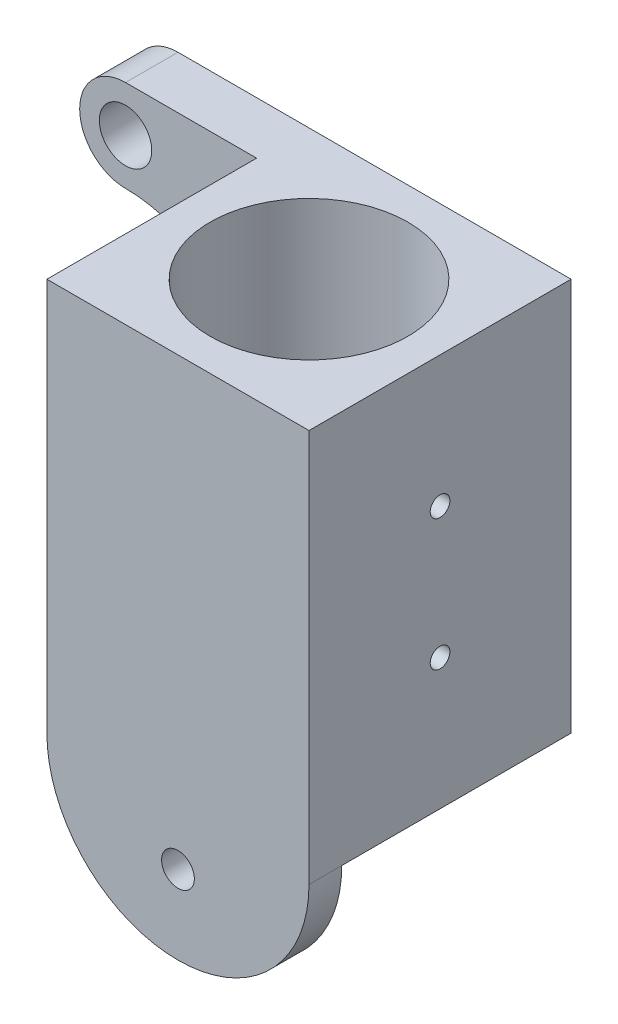
from build123d import *

# Parameters (mm, degrees)
SKETCH_1_W             = 40
SKETCH_1_H             = 40
EXTRUDE_1_DEPTH        = 60
SKETCH_2_R             = 15.1
CUT_EXTRUDE_1_DEPTH    = 50
SKETCH_3_R             = 2.5
EXTRUDE_2_DEPTH        = 5
SKETCH_4_R             = 1.5
CUT_EXTRUDE_2_DEPTH    = 75.833147735
PATTERN_LINEAR_1_COUNT = 2
PATTERN_LINEAR_1_PITCH = 20
SKETCH_5_W             = 8
SKETCH_5_H             = 14
EXTRUDE_3_DEPTH        = 27
FILLET_1_R             = 7
CUT_EXTRUDE_3_REACH    = 88.076
SKETCH_6_R             = 4
FILLET_2_R             = 20


with BuildPart() as part:
    # 草圖1 → 填料-伸長1 (new body)
    with BuildSketch(Plane(origin=(0, 0, 0), x_dir=(1, 0, 0), z_dir=(0, 1, 0))):
        Rectangle(SKETCH_1_W, SKETCH_1_H)
    extrude(amount=EXTRUDE_1_DEPTH)

    # 草圖2 → 除料-伸長1 (cut)
    with BuildSketch(Plane(origin=(0, 60, 0), x_dir=(1, 0, 0), z_dir=(0, 1, 0))):
        with Locations(Location((0, 0, 0), (0, 0, 270))):
            Circle(SKETCH_2_R)
    extrude(amount=-CUT_EXTRUDE_1_DEPTH, mode=Mode.SUBTRACT)

    # 草圖3 → 填料-伸長2 (add)
    with BuildSketch(Plane.XY.offset(20)):
        with BuildLine():
            Line((-20, 0), (20, 0))
            ThreePointArc((20, 0), (0, -20), (-20, 0))
        make_face()
        with Locations((0, -8)):
            Circle(SKETCH_3_R, mode=Mode.SUBTRACT)
    extrude(amount=-EXTRUDE_2_DEPTH)

    # 草圖4 → 除料-伸長2 (cut, through all)
    with BuildSketch(Plane(origin=(20, 0, 0), x_dir=(0, 0, -1), z_dir=(1, 0, 0))):
        with Locations((0, 20)):
            Circle(SKETCH_4_R)
    cut_extrude_2 = extrude(amount=-CUT_EXTRUDE_2_DEPTH, mode=Mode.SUBTRACT)

    # 直線複製排列1: 除料-伸長2 ×2
    with Locations(*[(0, i * PATTERN_LINEAR_1_PITCH, 0) for i in range(1, PATTERN_LINEAR_1_COUNT)]):
        add(cut_extrude_2, mode=Mode.SUBTRACT)

    # 草圖5 → 填料-伸長3 (add)
    with BuildSketch(Plane.ZY.offset(20)):
        with Locations((-16, 53)):
            Rectangle(SKETCH_5_W, SKETCH_5_H)
    extrude(amount=EXTRUDE_3_DEPTH)

    # 圓角1
    fillet_1_edges = [part.edges().sort_by_distance(p)[0] for p in [
        (-47, 46, -16),
        (-47, 60, -16),
    ]]
    fillet(fillet_1_edges, radius=FILLET_1_R - 0.0001)  # a hair under: the kernel refuses the full size

    # 草圖6 → 除料-伸長3 (cut, up to next)
    with BuildSketch(Plane(origin=(0, 0, -20), x_dir=(-1, 0, 0), z_dir=(0, 0, -1)), mode=Mode.PRIVATE) as cut_extrude_3_sk1:
        with Locations((40, 53)):
            Circle(SKETCH_6_R)
    cut_extrude_3_tool1 = extrude(cut_extrude_3_sk1.sketch, amount=-CUT_EXTRUDE_3_REACH, mode=Mode.PRIVATE) & part.part
    add(cut_extrude_3_tool1.solids().sort_by_distance((-40, 53, -20))[0], mode=Mode.SUBTRACT)

    # 圓角2
    fillet_2_edges = [part.edges().sort_by_distance(p)[0] for p in [
        (-20, 46, -16),
    ]]
    fillet(fillet_2_edges, radius=FILLET_2_R)


solid = part.part
